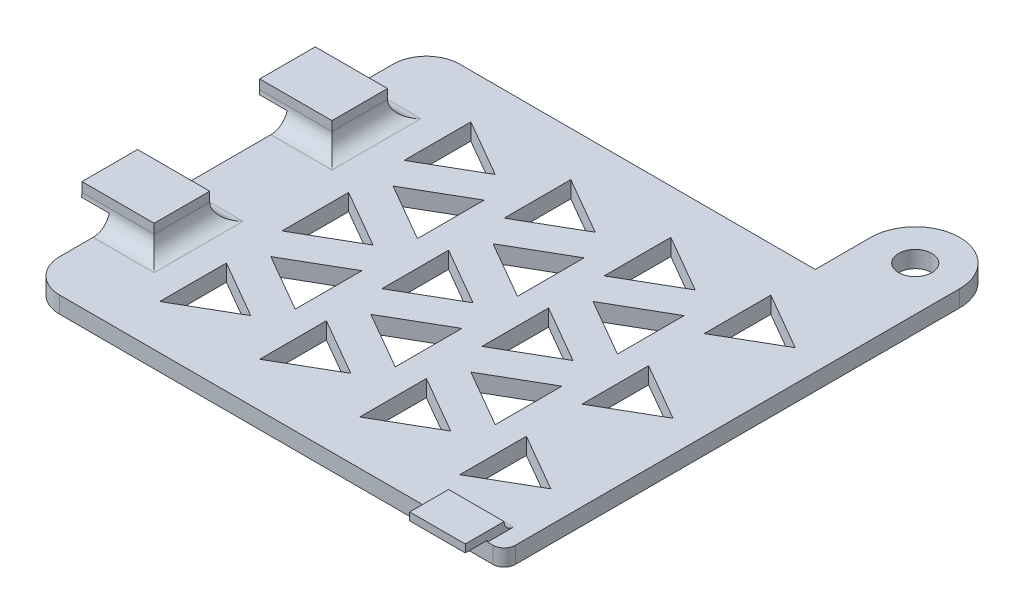
from build123d import *
from OCP.BRepFilletAPI import BRepFilletAPI_MakeFillet

# Parameters (mm, degrees)
SKETCH1_R                = 1.5
BOSS_EXTRUDE1_DEPTH      = 1.5
BOSS_EXTRUDE2_DEPTH      = 2
BOSS_EXTRUDE2_DEPTH_BACK = 1.5
SKETCH3_W                = 5
SKETCH3_H                = 0.7
SKETCH4_W                = 5
SKETCH4_H                = 1.5
BOSS_EXTRUDE3_DEPTH      = 0.15
FILLET2_R                = 0.85
SKETCH5_W                = 5
SKETCH5_H                = 1.2
BOSS_EXTRUDE4_DEPTH      = 2.5
BOSS_EXTRUDE4_2_DEPTH    = 2.5
SKETCH6_W                = 4
SKETCH6_H                = 5
BOSS_EXTRUDE5_DEPTH      = 2.35
FILLET3_R                = 1.5
CUT_EXTRUDE1_DEPTH       = 2.5
FILLET4_R1               = 3
FILLET4_R2               = 1


with BuildPart() as part:
    # Sketch1 → Boss-Extrude1 (new body)
    with BuildSketch(Plane(origin=(0, 0, 0), x_dir=(1, 0, 0), z_dir=(0, 1, 0))):
        with BuildLine():
            Line((0, 0), (43, 0))
            Line((43, 0), (43, 36))
            Line((43, 36), (43, 41))
            ThreePointArc((43, 41), (39, 45), (35, 41))
            Line((35, 41), (35, 36))
            Line((35, 36), (0, 36))
            Line((0, 36), (0, 0))
        make_face()
        with Locations(Location((39, 41, 0), (0, 0, 270))):
            Circle(SKETCH1_R, mode=Mode.SUBTRACT)
    extrude(amount=BOSS_EXTRUDE1_DEPTH)



with BuildPart() as body_2:
    # Sketch3 → Boss-Extrude2 (new, two sides: drawn at the far end of the back side and taken through both)
    with BuildSketch(Plane.XY.offset(-BOSS_EXTRUDE2_DEPTH_BACK)):
        with Locations((39, 2)):
            Rectangle(SKETCH3_W, SKETCH3_H)
    extrude(amount=BOSS_EXTRUDE2_DEPTH + BOSS_EXTRUDE2_DEPTH_BACK)


with BuildPart() as part_1:
    add(part.part)

    add(body_2.part)  # Boss-Extrude3 merges body 2
    # Sketch4 → Boss-Extrude3 (add)
    with BuildSketch(Plane.XZ.offset(-1.65)):
        with Locations((39, -0.75)):
            Rectangle(SKETCH4_W, SKETCH4_H)
    extrude(amount=BOSS_EXTRUDE3_DEPTH)

    # Fillet2
    fillet2_edges = [part_1.edges().sort_by_distance(p)[0] for p in [
        (39, 1.5, -1.5),
    ]]
    fillet(fillet2_edges, radius=FILLET2_R - 0.0001)  # a hair under: the kernel refuses the full size



with BuildPart() as body_2_2:
    # Sketch5 → Boss-Extrude4 (new body)
    with BuildSketch(Plane.ZY):
        with Locations((-10, 3.25)):
            Rectangle(SKETCH5_W, SKETCH5_H)
    extrude(amount=BOSS_EXTRUDE4_DEPTH)


with BuildPart() as body_3:
    # Sketch5 → Boss-Extrude4 2 (new body)
    with BuildSketch(Plane.ZY):
        with Locations((-26, 3.25)):
            Rectangle(SKETCH5_W, SKETCH5_H)
    extrude(amount=BOSS_EXTRUDE4_2_DEPTH)


with BuildPart() as part_2:
    add(part_1.part)

    add(body_2_2.part)  # Boss-Extrude5 merges body 2 2

    add(body_3.part)  # Boss-Extrude5 merges body 3
    # Sketch6 → Boss-Extrude5 (add)
    with BuildSketch(Plane(origin=(0, 1.5, 0), x_dir=(1, 0, 0), z_dir=(0, 1, 0))):
        with Locations((2, 26)):
            Rectangle(SKETCH6_W, SKETCH6_H)
        with Locations((2, 10)):
            Rectangle(SKETCH6_W, SKETCH6_H)
    extrude(amount=BOSS_EXTRUDE5_DEPTH)

    # Fillet3
    fillet3_edges = [part_2.edges().sort_by_distance(p)[0] for p in [
        (2, 1.5, -7.5),
    ]]
    fillet(fillet3_edges, radius=FILLET3_R)
    fillet3_2_edges = [part_2.edges().sort_by_distance(p)[0] for p in [
        (4, 1.5, -10),
    ]]
    fillet(fillet3_2_edges, radius=FILLET3_R)
    fillet3_3_edges = [part_2.edges().sort_by_distance(p)[0] for p in [
        (2, 1.5, -12.5),
    ]]
    fillet(fillet3_3_edges, radius=FILLET3_R)
    fillet3_4_edges = [part_2.edges().sort_by_distance(p)[0] for p in [
        (2, 1.5, -23.5),
    ]]
    fillet(fillet3_4_edges, radius=FILLET3_R)
    fillet3_5_edges = [part_2.edges().sort_by_distance(p)[0] for p in [
        (4, 1.5, -26),
    ]]
    fillet(fillet3_5_edges, radius=FILLET3_R - 0.0001)  # a hair under: the kernel refuses the full size
    fillet3_6_edges = [part_2.edges().sort_by_distance(p)[0] for p in [
        (2, 1.5, -28.5),
    ]]
    fillet(fillet3_6_edges, radius=FILLET3_R - 0.0001)  # a hair under: the kernel refuses the full size

    # Sketch7 → Cut-Extrude1 (cut)
    with BuildSketch(Plane(origin=(0, 1.5, 0), x_dir=(1, 0, 0), z_dir=(0, 1, 0))):
        Polygon((13.196152423, 29), (8, 32), (8, 26), align=None)
        Polygon((17, 26), (22.196152423, 29), (17, 32), align=None)
        Polygon((26, 26), (31.196152423, 29), (26, 32), align=None)
        Polygon((35, 26), (40.196152423, 29), (35, 32), align=None)
        Polygon((13.196152423, 18), (8, 21), (8, 15), align=None)
        Polygon((17, 15), (22.196152423, 18), (17, 21), align=None)
        Polygon((26, 15), (31.196152423, 18), (26, 21), align=None)
        Polygon((35, 15), (40.196152423, 18), (35, 21), align=None)
        Polygon((13.196152423, 7), (8, 10), (8, 4), align=None)
        Polygon((17, 4), (22.196152423, 7), (17, 10), align=None)
        Polygon((26, 4), (31.196152423, 7), (26, 10), align=None)
        Polygon((35, 4), (40.196152423, 7), (35, 10), align=None)
        Polygon((9.5, 23.5), (14.696152423, 26.5), (14.696152423, 20.5), align=None)
        Polygon((23.696152423, 20.5), (18.5, 23.5), (23.696152423, 26.5), align=None)
        Polygon((32.696152423, 20.5), (27.5, 23.5), (32.696152423, 26.5), align=None)
        Polygon((14.696152423, 9.5), (9.5, 12.5), (14.696152423, 15.5), align=None)
        Polygon((18.5, 12.5), (23.696152423, 15.5), (23.696152423, 9.5), align=None)
        Polygon((32.696152423, 9.5), (27.5, 12.5), (32.696152423, 15.5), align=None)
    extrude(amount=-CUT_EXTRUDE1_DEPTH, mode=Mode.SUBTRACT)

    # Fillet4: one fillet with a radius per group of edges: ONE call of the kernel's fillet builder (fillet() takes one radius for all edges)
    fillet4_edges_1 = [part_2.edges().sort_by_distance(p)[0] for p in [
        (0, 0.75, 0),
        (0, 0.75, -36),
    ]]
    fillet4_edges_2 = [part_2.edges().sort_by_distance(p)[0] for p in [
        (43, 0.75, 0),
    ]]
    fillet4 = BRepFilletAPI_MakeFillet(part_2.part.solid().wrapped)
    for e in fillet4_edges_1:
        fillet4.Add(FILLET4_R1, e.wrapped)
    for e in fillet4_edges_2:
        fillet4.Add(FILLET4_R2, e.wrapped)
    add(Compound.cast(fillet4.Shape()), mode=Mode.REPLACE)


solid = part_2.part
